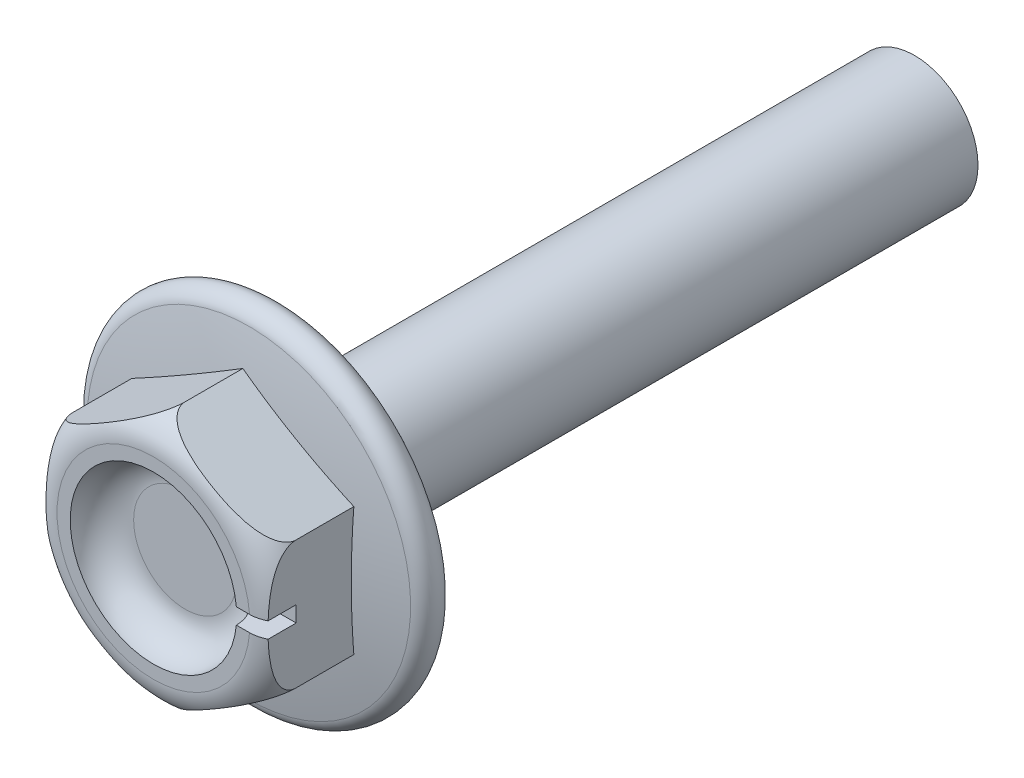
from build123d import *

# Parameters (mm, degrees)
HEAD_DEPTH         = 4
SHANK_SKETCH_R     = 2
SHANK_DEPTH        = 20
SKETCH6_R          = 2.625
HEAD_CUT_DEPTH     = 1
FILLET1_R          = 1
SKETCH8_W          = 3.5
SKETCH8_H          = 0.5
CUT_EXTRUDE3_DEPTH = 1


with BuildPart() as part:
    # Head Sketch → Head (new body)
    with BuildSketch(Plane.XY):
        Polygon((0, 4.041451884), (3.5, 2.020725942), (3.5, -2.020725942), (0, -4.041451884), (-3.5, -2.020725942), (-3.5, 2.020725942), align=None)
    extrude(amount=HEAD_DEPTH)

    # Shank Sketch → Shank (add)
    with BuildSketch(Plane.XY):
        Circle(SHANK_SKETCH_R)
    extrude(amount=-SHANK_DEPTH)

    # Sketch3 → Flange (revolve)
    with BuildSketch(Plane(origin=(0, 0, 0), x_dir=(-1, 0, 0), z_dir=(0, 1, 0)), mode=Mode.PRIVATE) as flange_sk:
        with BuildLine():
            Line((-5, 0), (0, 0))
            Line((0, 0), (0, 1.5))
            ThreePointArc((0, 1.5), (-2.562220765, 1.372207648), (-5.099009901, 0.99009901))
            ThreePointArc((-5.099009901, 0.99009901), (-5.497518595, 0.45024814), (-5, 0))
        make_face()
    revolve(flange_sk.sketch.rotate(Axis((0, 0, 0), (0, 0, 1)), 30), axis=Axis((0, 0, 0), (0, 0, 1)))

    # Sketch5 → Head Trim (revolve, cut)
    with BuildSketch(Plane(origin=(0, 0, 0), x_dir=(0, 0, -1), z_dir=(1, 0, 0)), mode=Mode.PRIVATE) as head_trim_sk:
        with BuildLine():
            Line((-4, -3.041451884), (-4, -4.041451884))
            Line((-4, -4.041451884), (-3, -4.041451884))
            ThreePointArc((-3, -4.041451884), (-3.707106781, -3.748558666), (-4, -3.041451884))
        make_face()
    revolve(head_trim_sk.sketch.rotate(Axis((0, 0, 15.085599173), (0, 0, -1)), 90), axis=Axis((0, 0, 15.085599173), (0, 0, -1)), mode=Mode.SUBTRACT)

    # Sketch6 → Head Cut (cut)
    with BuildSketch(Plane.XY.offset(4)):
        Circle(SKETCH6_R)
    extrude(amount=-HEAD_CUT_DEPTH, mode=Mode.SUBTRACT)

    # Fillet1
    fillet1_edges = [part.edges().sort_by_distance(p)[0] for p in [
        (-2.625, 0, 3),
    ]]
    fillet(fillet1_edges, radius=FILLET1_R - 0.0001)  # a hair under: the kernel refuses the full size

    # Sketch8 → Cut-Extrude3 (cut)
    with BuildSketch(Plane.XY.offset(4)):
        with Locations((1.75, 0)):
            Rectangle(SKETCH8_W, SKETCH8_H)
    extrude(amount=-CUT_EXTRUDE3_DEPTH, mode=Mode.SUBTRACT)


solid = part.part
